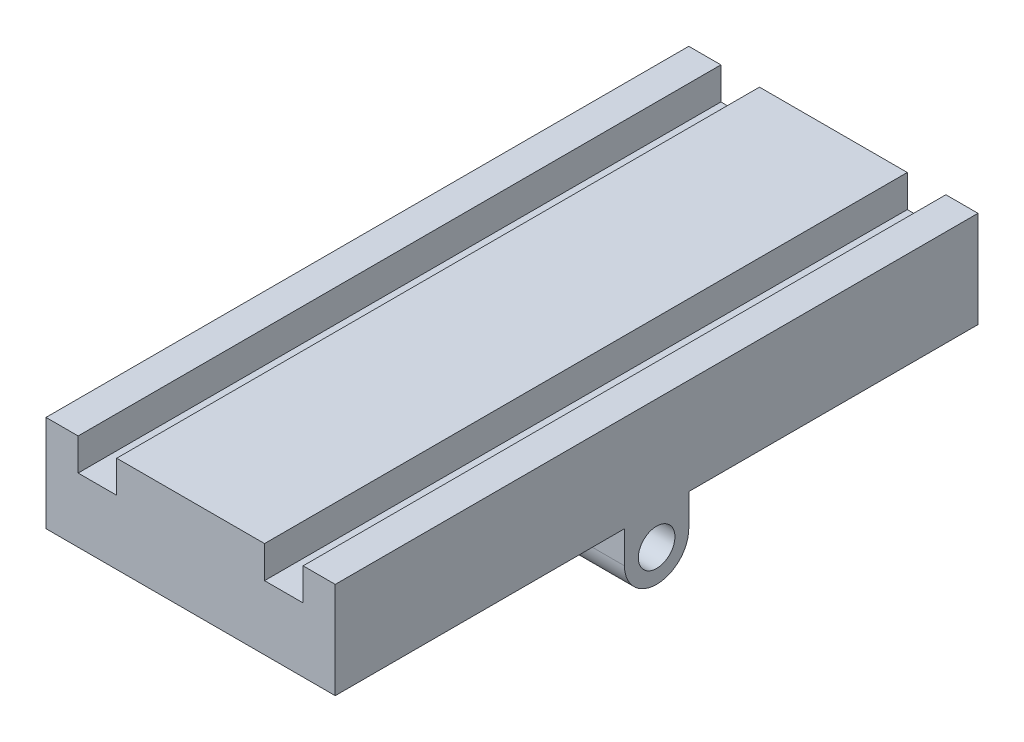
from build123d import *

# Parameters (mm, degrees)
BOSS_EXTRUDE1_DEPTH = 100
SKETCH2_W           = 10
SKETCH2_H           = 5
BOSS_EXTRUDE3_DEPTH = 45
SKETCH3_R           = 5
BOSS_EXTRUDE4_DEPTH = 45
SKETCH4_R           = 2.85
CUT_EXTRUDE1_DEPTH  = 45


with BuildPart() as part:
    # Sketch1 → Boss-Extrude1 (new body)
    with BuildSketch(Plane.XY):
        Polygon((-11.5, 5), (11.5, 5), (11.5, 0), (17.5, 0), (17.5, 5), (22.5, 5), (22.5, -10), (-22.5, -10), (-22.5, 5), (-17.5, 5), (-17.5, 0), (-11.5, 0), align=None)
    extrude(amount=BOSS_EXTRUDE1_DEPTH)

    # Sketch2 → Boss-Extrude3 (add)
    with BuildSketch(Plane.ZY.offset(22.5)):
        with Locations((50, -12.5)):
            Rectangle(SKETCH2_W, SKETCH2_H)
    extrude(amount=-BOSS_EXTRUDE3_DEPTH)

    # Sketch3 → Boss-Extrude4 (add)
    with BuildSketch(Plane.ZY.offset(22.5)):
        with Locations((50, -15)):
            Circle(SKETCH3_R)
    extrude(amount=-BOSS_EXTRUDE4_DEPTH)

    # Sketch4 → Cut-Extrude1 (cut)
    with BuildSketch(Plane.ZY.offset(22.5)):
        with Locations((50, -15)):
            Circle(SKETCH4_R)
    extrude(amount=-CUT_EXTRUDE1_DEPTH, mode=Mode.SUBTRACT)


solid = part.part
